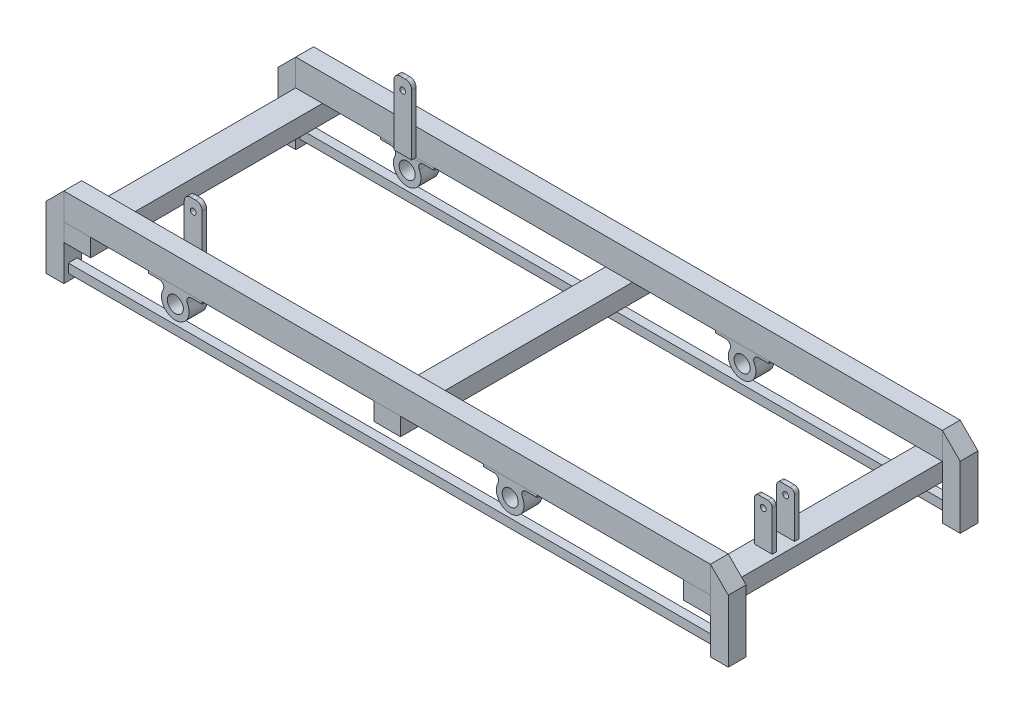
from build123d import *

# Parameters (mm, degrees)
SKETCH1_W             = 40
SKETCH1_H             = 40
BOSS_EXTRUDE1_DEPTH   = 180
BOSS_EXTRUDE1_2_DEPTH = 180
BOSS_EXTRUDE1_3_DEPTH = 180
BOSS_EXTRUDE1_4_DEPTH = 180
CHAMFER1_SIZE         = 40
CHAMFER2_SIZE         = 40
CHAMFER3_SIZE         = 40
CHAMFER4_SIZE         = 40
SKETCH2_W             = 1450
SKETCH2_H             = 60
BOSS_EXTRUDE2_DEPTH   = 40
SKETCH3_W             = 60
SKETCH3_H             = 40
BOSS_EXTRUDE3_DEPTH   = 560
BOSS_EXTRUDE3_2_DEPTH = 560
BOSS_EXTRUDE3_3_DEPTH = 560
SKETCH4_W             = 20
SKETCH4_H             = 20
BOSS_EXTRUDE4_DEPTH   = 1450
SKETCH5_R             = 6.5
BOSS_EXTRUDE5_DEPTH   = 10
SKETCH6_W             = 120
SKETCH6_H             = 40
BOSS_EXTRUDE6_DEPTH   = 5
BOSS_EXTRUDE6_2_DEPTH = 5
SKETCH7_R             = 31
SKETCH7_R_2           = 18
BOSS_EXTRUDE7_DEPTH   = 40
FILLET1_R             = 10
SKETCH9_R             = 18
BOSS_EXTRUDE8_DEPTH   = 40
SKETCH10_W            = 10
SKETCH10_H            = 100
SKETCH10_W_2          = 9
BOSS_EXTRUDE9_DEPTH   = 20
FILLET2_R             = 10
SKETCH11_R            = 6.5
CUT_EXTRUDE1_DEPTH    = 62


with BuildPart() as part:
    # Sketch1 → Boss-Extrude1 (new body)
    with BuildSketch(Plane(origin=(0, 0, 0), x_dir=(1, 0, 0), z_dir=(0, 1, 0))):
        with Locations((-745, 260)):
            Rectangle(SKETCH1_W, SKETCH1_H)
    extrude(amount=-BOSS_EXTRUDE1_DEPTH)

    # Chamfer1
    chamfer1_edges = [part.edges().sort_by_distance(p)[0] for p in [
        (-765, 0, -260),
    ]]
    chamfer(chamfer1_edges, length=CHAMFER1_SIZE - 0.0001)  # a hair under: the kernel refuses the full size



with BuildPart() as body_2:
    # Sketch1 → Boss-Extrude1 2 (new body)
    with BuildSketch(Plane(origin=(0, 0, 0), x_dir=(1, 0, 0), z_dir=(0, 1, 0))):
        with Locations((-745, -260)):
            Rectangle(SKETCH1_W, SKETCH1_H)
    extrude(amount=-BOSS_EXTRUDE1_2_DEPTH)

    # Chamfer2
    chamfer2_edges = [body_2.edges().sort_by_distance(p)[0] for p in [
        (-765, 0, 260),
    ]]
    chamfer(chamfer2_edges, length=CHAMFER2_SIZE - 0.0001)  # a hair under: the kernel refuses the full size


with BuildPart() as body_3:
    # Sketch1 → Boss-Extrude1 3 (new body)
    with BuildSketch(Plane(origin=(0, 0, 0), x_dir=(1, 0, 0), z_dir=(0, 1, 0))):
        with Locations((745, -260)):
            Rectangle(SKETCH1_W, SKETCH1_H)
    extrude(amount=-BOSS_EXTRUDE1_3_DEPTH)

    # Chamfer4
    chamfer4_edges = [body_3.edges().sort_by_distance(p)[0] for p in [
        (765, 0, 260),
    ]]
    chamfer(chamfer4_edges, length=CHAMFER4_SIZE - 0.0001)  # a hair under: the kernel refuses the full size


with BuildPart() as body_4:
    # Sketch1 → Boss-Extrude1 4 (new body)
    with BuildSketch(Plane(origin=(0, 0, 0), x_dir=(1, 0, 0), z_dir=(0, 1, 0))):
        with Locations((745, 260)):
            Rectangle(SKETCH1_W, SKETCH1_H)
    extrude(amount=-BOSS_EXTRUDE1_4_DEPTH)

    # Chamfer3
    chamfer3_edges = [body_4.edges().sort_by_distance(p)[0] for p in [
        (765, 0, -260),
    ]]
    chamfer(chamfer3_edges, length=CHAMFER3_SIZE - 0.0001)  # a hair under: the kernel refuses the full size


with BuildPart() as body_5:
    # Sketch2 → Boss-Extrude2 (new body)
    with BuildSketch(Plane.XY.offset(280)):
        with Locations((0, -30)):
            Rectangle(SKETCH2_W, SKETCH2_H)
    extrude(amount=-BOSS_EXTRUDE2_DEPTH)


with BuildPart() as body_6:
    # Mirror2: mirrored copy
    add(body_5.part.mirror(Plane.XY))


with BuildPart() as body_7:
    # Sketch3 → Boss-Extrude3 (new body)
    with BuildSketch(Plane.XY.offset(280)):
        with Locations((695, -80)):
            Rectangle(SKETCH3_W, SKETCH3_H)
    extrude(amount=-BOSS_EXTRUDE3_DEPTH)

    # Sketch10 → Boss-Extrude9 (add, symmetric)
    with BuildSketch(Plane(origin=(695, 0, 0), x_dir=(0, 0, -1), z_dir=(1, 0, 0))):
        with Locations((-76.405210322, -10)):
            Rectangle(SKETCH10_W, SKETCH10_H)
        with Locations((-126.905210322, -10)):
            Rectangle(SKETCH10_W_2, SKETCH10_H)
    extrude(amount=BOSS_EXTRUDE9_DEPTH, both=True)

    # Fillet2
    fillet2_edges = [body_7.edges().sort_by_distance(p)[0] for p in [
        (675, 40, 76.405210322),
        (715, 40, 76.405210322),
        (675, 40, 126.905210322),
        (715, 40, 126.905210322),
    ]]
    fillet(fillet2_edges, radius=FILLET2_R)

    # Sketch11 → Cut-Extrude1 (cut)
    with BuildSketch(Plane.XY.offset(131.405210322)):
        with Locations((695, 20)):
            Circle(SKETCH11_R)
    extrude(amount=-CUT_EXTRUDE1_DEPTH, mode=Mode.SUBTRACT)


with BuildPart() as body_8:
    # Sketch3 → Boss-Extrude3 2 (new body)
    with BuildSketch(Plane.XY.offset(280)):
        with Locations((-695, -80)):
            Rectangle(SKETCH3_W, SKETCH3_H)
    extrude(amount=-BOSS_EXTRUDE3_2_DEPTH)


with BuildPart() as body_9:
    # Sketch3 → Boss-Extrude3 3 (new body)
    with BuildSketch(Plane.XY.offset(280)):
        with Locations((0, -80)):
            Rectangle(SKETCH3_W, SKETCH3_H)
    extrude(amount=-BOSS_EXTRUDE3_3_DEPTH)


with BuildPart() as part_1:
    add(part.part)

    add(body_2.part)  # Boss-Extrude4 merges body 2

    add(body_3.part)  # Boss-Extrude4 merges body 3

    add(body_4.part)  # Boss-Extrude4 merges body 4
    # Sketch4 → Boss-Extrude4 (add)
    with BuildSketch(Plane(origin=(-725, 0, 0), x_dir=(0, 0, -1), z_dir=(1, 0, 0))):
        with Locations((-260, -155)):
            Rectangle(SKETCH4_W, SKETCH4_H)
        with Locations((260, -155)):
            Rectangle(SKETCH4_W, SKETCH4_H)
    extrude(amount=BOSS_EXTRUDE4_DEPTH)


with BuildPart() as body_7_2:
    # Sketch5 → Boss-Extrude5 (new body)
    with BuildSketch(Plane.XY.offset(-240)):
        with BuildLine():
            Line((-495, -60), (-455, -60))
            Line((-455, -60), (-455, 76))
            ThreePointArc((-455, 76), (-459.100505063, 85.899494937), (-469, 90))
            Line((-469, 90), (-481, 90))
            ThreePointArc((-481, 90), (-490.899494937, 85.899494937), (-495, 76))
            Line((-495, 76), (-495, -60))
        make_face()
        with Locations((-475, 65)):
            Circle(SKETCH5_R, mode=Mode.SUBTRACT)
    extrude(amount=BOSS_EXTRUDE5_DEPTH)


with BuildPart() as body_8_2:
    # Mirror4: mirrored copy
    add(body_7_2.part.mirror(Plane.XY))


with BuildPart() as body_9_2:
    # Sketch6 → Boss-Extrude6 (new body)
    with BuildSketch(Plane.XZ.offset(60)):
        with Locations((-475, 260)):
            Rectangle(SKETCH6_W, SKETCH6_H)
    extrude(amount=BOSS_EXTRUDE6_DEPTH)

    # Sketch7 → Boss-Extrude7 (add)
    with BuildSketch(Plane.XY.offset(280)):
        with Locations((-475, -95)):
            Circle(SKETCH7_R)
        with Locations((-475, -95)):
            Circle(SKETCH7_R_2, mode=Mode.SUBTRACT)
    extrude(amount=-BOSS_EXTRUDE7_DEPTH)

    # Fillet1
    fillet1_edges = [body_9_2.edges().sort_by_distance(p)[0] for p in [
        (-482.810249676, -65, 260),
        (-467.189750324, -65, 260),
    ]]
    fillet(fillet1_edges, radius=FILLET1_R)


with BuildPart() as body_10:
    # Sketch6 → Boss-Extrude6 2 (new body)
    with BuildSketch(Plane.XZ.offset(60)):
        with Locations((-475, -260)):
            Rectangle(SKETCH6_W, SKETCH6_H)
    extrude(amount=BOSS_EXTRUDE6_2_DEPTH)


with BuildPart() as body_11:
    # Mirror6: mirrored copy
    add(body_9_2.part.mirror(Plane.XY))


with BuildPart() as body_12:
    # Sketch9 → Boss-Extrude8 (new body)
    with BuildSketch(Plane.XY.offset(280)):
        with BuildLine():
            Line((336, -65), (336, -60))
            Line((336, -60), (216, -60))
            Line((216, -60), (216, -65))
            Line((216, -65), (240.208939664, -65))
            ThreePointArc((240.208939664, -65), (248.833917571, -69.939391727), (248.938466575, -79.87804878))
            ThreePointArc((248.938466575, -79.87804878), (276, -126), (303.061533425, -79.87804878))
            ThreePointArc((303.061533425, -79.87804878), (303.166082429, -69.939391727), (311.791060336, -65))
            Line((311.791060336, -65), (336, -65))
        make_face()
        with Locations((276, -95)):
            Circle(SKETCH9_R, mode=Mode.SUBTRACT)
    extrude(amount=-BOSS_EXTRUDE8_DEPTH)


with BuildPart() as body_13:
    # Mirror7: mirrored copy
    add(body_12.part.mirror(Plane.XY))


solid = Compound([body_5.part, body_6.part, body_7.part, body_8.part, body_9.part, part_1.part, body_7_2.part, body_8_2.part, body_9_2.part, body_10.part, body_11.part, body_12.part, body_13.part])
